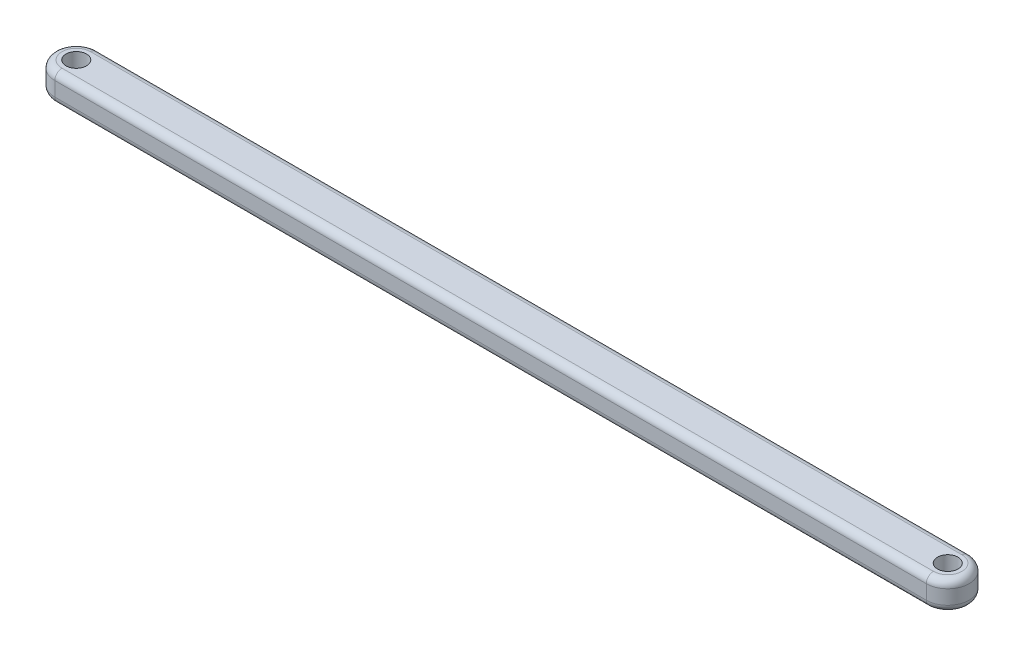
from build123d import *

# Parameters (mm, degrees)
BOSS_EXTRUDE1_DEPTH = 3.175
SKETCH2_R           = 2.286
CUT_EXTRUDE1_DEPTH  = 199.596186551
FILLET1_R           = 1.5875


with BuildPart() as part:
    # Sketch1 → Boss-Extrude1 (new, symmetric)
    with BuildSketch(Plane(origin=(0, 0, 0), x_dir=(1, 0, 0), z_dir=(0, 1, 0))):
        with BuildLine():
            Line((0, 4.7625), (193.675, 4.7625))
            ThreePointArc((193.675, 4.7625), (198.4375, 0), (193.675, -4.7625))
            Line((193.675, -4.7625), (0, -4.7625))
            ThreePointArc((0, -4.7625), (-4.7625, 0), (0, 4.7625))
        make_face()
    extrude(amount=BOSS_EXTRUDE1_DEPTH, both=True)

    # Sketch2 → Cut-Extrude1 (cut, through all)
    with BuildSketch(Plane(origin=(0, 3.175, 0), x_dir=(1, 0, 0), z_dir=(0, 1, 0))):
        Circle(SKETCH2_R)
        with Locations((193.675, 0)):
            Circle(SKETCH2_R)
    extrude(amount=-CUT_EXTRUDE1_DEPTH, mode=Mode.SUBTRACT)

    # Fillet1
    fillet1_edges = [part.edges().sort_by_distance(p)[0] for p in [
        (198.4375, -3.175, 0),
        (96.8375, -3.175, 4.7625),
        (-4.7625, -3.175, 0),
        (198.4375, 3.175, 0),
        (96.8375, 3.175, 4.7625),
        (-4.7625, 3.175, 0),
        (96.8375, -3.175, -4.7625),
        (96.8375, 3.175, -4.7625),
    ]]
    fillet(fillet1_edges, radius=FILLET1_R)


solid = part.part
